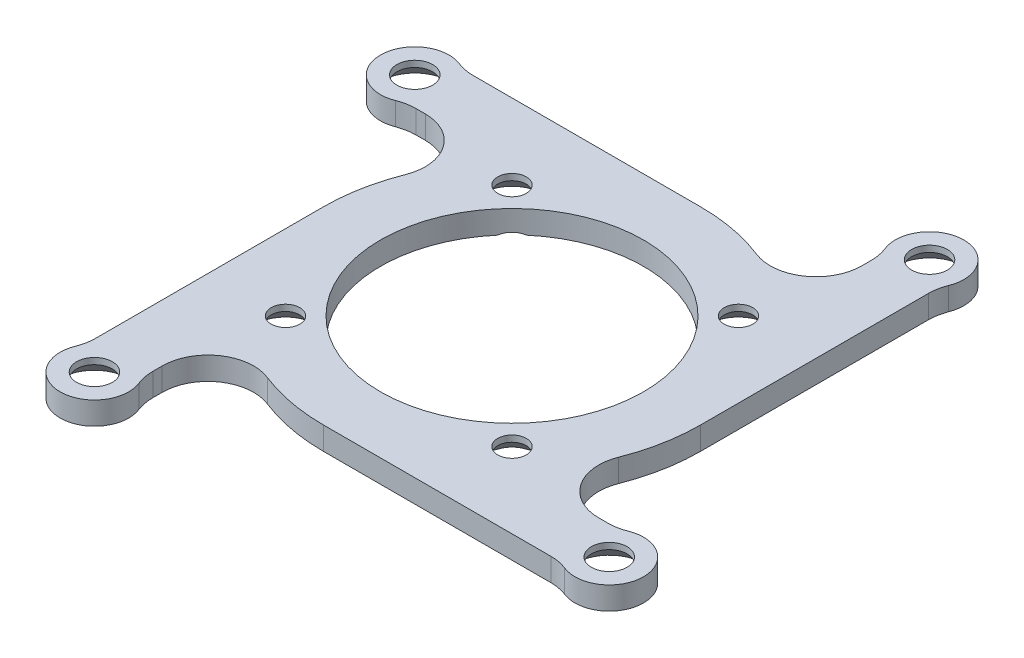
from build123d import *

# Parameters (mm, degrees)
SKETCH1_R           = 23
SKETCH1_R_2         = 2.5
SKETCH1_R_3         = 3.125
BOSS_EXTRUDE1_DEPTH = 4
FILLET1_R           = 8
CHAMFER1_SIZE       = 2.9


with BuildPart() as part:
    # Sketch1 → Boss-Extrude1 (new body)
    with BuildSketch(Plane(origin=(0, 0, 0), x_dir=(1, 0, 0), z_dir=(0, 1, 0))):
        with BuildLine():
            Line((-41.68337521, 33), (0, 33))
            ThreePointArc((0, 33), (12.411234198, 30.577136322), (23, 23.664319132))
            Line((23, 23.664319132), (23, 41.68337521))
            ThreePointArc((23, 41.68337521), (28, 51), (33, 41.68337521))
            Line((33, 41.68337521), (33, 0))
            ThreePointArc((33, 0), (30.577136322, -12.411234198), (23.664319132, -23))
            Line((23.664319132, -23), (41.68337521, -23))
            ThreePointArc((41.68337521, -23), (51, -28), (41.68337521, -33))
            Line((41.68337521, -33), (0, -33))
            ThreePointArc((0, -33), (-12.411234198, -30.577136322), (-23, -23.664319132))
            Line((-23, -23.664319132), (-23, -41.68337521))
            ThreePointArc((-23, -41.68337521), (-28, -51), (-33, -41.68337521))
            Line((-33, -41.68337521), (-33, 0))
            ThreePointArc((-33, 0), (-30.577136322, 12.411234198), (-23.664319132, 23))
            Line((-23.664319132, 23), (-41.68337521, 23))
            ThreePointArc((-41.68337521, 23), (-51, 28), (-41.68337521, 33))
        make_face()
        with Locations(Location((0, 0, 0), (0, 0, 270))):
            Circle(SKETCH1_R, mode=Mode.SUBTRACT)
        with Locations(Location((-19.798989873, 19.798989873, 0), (0, 0, 270))):
            Circle(SKETCH1_R_2, mode=Mode.SUBTRACT)
        with Locations(Location((19.798989873, 19.798989873, 0), (0, 0, 270))):
            Circle(SKETCH1_R_2, mode=Mode.SUBTRACT)
        with Locations(Location((19.798989873, -19.798989873, 0), (0, 0, 270))):
            Circle(SKETCH1_R_2, mode=Mode.SUBTRACT)
        with Locations(Location((-19.798989873, -19.798989873, 0), (0, 0, 270))):
            Circle(SKETCH1_R_2, mode=Mode.SUBTRACT)
        with Locations(Location((-45, 28, 0), (0, 0, 270))):
            Circle(SKETCH1_R_3, mode=Mode.SUBTRACT)
        with Locations(Location((28, 45, 0), (0, 0, 270))):
            Circle(SKETCH1_R_3, mode=Mode.SUBTRACT)
        with Locations(Location((45, -28, 0), (0, 0, 270))):
            Circle(SKETCH1_R_3, mode=Mode.SUBTRACT)
        with Locations(Location((-28, -45, 0), (0, 0, 270))):
            Circle(SKETCH1_R_3, mode=Mode.SUBTRACT)
    extrude(amount=BOSS_EXTRUDE1_DEPTH)

    # Fillet1
    fillet1_edges = [part.edges().sort_by_distance(p)[0] for p in [
        (-41.68337521, 2, -33),
        (23, 2, -23.664319132),
        (23, 2, -41.68337521),
        (33, 2, -41.68337521),
        (23.664319132, 2, 23),
        (41.68337521, 2, 23),
        (41.68337521, 2, 33),
        (-23, 2, 23.664319132),
        (-23, 2, 41.68337521),
        (-33, 2, 41.68337521),
        (-23.664319132, 2, -23),
        (-41.68337521, 2, -23),
    ]]
    fillet(fillet1_edges, radius=FILLET1_R)

    # Chamfer1
    # the kernel refuses this chamfer: 2.9 mm, written as the material it takes off along each edge
    with BuildSketch(Plane(origin=(-45, 0, -28), x_dir=(0, 0, 1), z_dir=(-1, 0, 0))) as chamfer1_piece_1:
        Polygon((3.125 + CHAMFER1_SIZE, 0), (3.125, CHAMFER1_SIZE), (3.125, 0), align=None)
    revolve(axis=Axis((-45, 0, -28), (0, 1, 0)), mode=Mode.SUBTRACT)
    with BuildSketch(Plane(origin=(-28, 0, 45), x_dir=(0, 0, 1), z_dir=(-1, 0, 0))) as chamfer1_piece_2:
        Polygon((3.125 + CHAMFER1_SIZE, 0), (3.125, CHAMFER1_SIZE), (3.125, 0), align=None)
    revolve(axis=Axis((-28, 0, 45), (0, 1, 0)), mode=Mode.SUBTRACT)
    with BuildSketch(Plane(origin=(45, 0, 28), x_dir=(0, 0, 1), z_dir=(-1, 0, 0))) as chamfer1_piece_3:
        Polygon((3.125 + CHAMFER1_SIZE, 0), (3.125, CHAMFER1_SIZE), (3.125, 0), align=None)
    revolve(axis=Axis((45, 0, 28), (0, 1, 0)), mode=Mode.SUBTRACT)
    with BuildSketch(Plane(origin=(28, 0, -45), x_dir=(0, 0, 1), z_dir=(-1, 0, 0))) as chamfer1_piece_4:
        Polygon((3.125 + CHAMFER1_SIZE, 0), (3.125, CHAMFER1_SIZE), (3.125, 0), align=None)
    revolve(axis=Axis((28, 0, -45), (0, 1, 0)), mode=Mode.SUBTRACT)
    with BuildSketch(Plane(origin=(19.798989873, 0, -19.798989873), x_dir=(0, 0, 1), z_dir=(-1, 0, 0))) as chamfer1_piece_5:
        Polygon((2.5 + CHAMFER1_SIZE, 0), (2.5, CHAMFER1_SIZE), (2.5, 0), align=None)
    revolve(axis=Axis((19.798989873, 0, -19.798989873), (0, 1, 0)), mode=Mode.SUBTRACT)
    with BuildSketch(Plane(origin=(19.798989873, 0, 19.798989873), x_dir=(0, 0, 1), z_dir=(-1, 0, 0))) as chamfer1_piece_6:
        Polygon((2.5 + CHAMFER1_SIZE, 0), (2.5, CHAMFER1_SIZE), (2.5, 0), align=None)
    revolve(axis=Axis((19.798989873, 0, 19.798989873), (0, 1, 0)), mode=Mode.SUBTRACT)
    with BuildSketch(Plane(origin=(-19.798989873, 0, 19.798989873), x_dir=(0, 0, 1), z_dir=(-1, 0, 0))) as chamfer1_piece_7:
        Polygon((2.5 + CHAMFER1_SIZE, 0), (2.5, CHAMFER1_SIZE), (2.5, 0), align=None)
    revolve(axis=Axis((-19.798989873, 0, 19.798989873), (0, 1, 0)), mode=Mode.SUBTRACT)
    with BuildSketch(Plane(origin=(-19.798989873, 0, -19.798989873), x_dir=(0, 0, 1), z_dir=(-1, 0, 0))) as chamfer1_piece_8:
        Polygon((2.5 + CHAMFER1_SIZE, 0), (2.5, CHAMFER1_SIZE), (2.5, 0), align=None)
    revolve(axis=Axis((-19.798989873, 0, -19.798989873), (0, 1, 0)), mode=Mode.SUBTRACT)

    # Chamfer2
    # the kernel refuses this chamfer: 1 mm, written as the material it takes off along each edge
    with BuildSketch(Plane(origin=(15, 0, -39.803847577), x_dir=(1, 0, 0), z_dir=(0, 0, 1))) as chamfer2_piece_1:
        with BuildLine():
            Line((9.028284271, -0.028284271), (7.971715729, 1.028284271))
            Line((7.971715729, 1.028284271), (7.951715729, 1.028284271))
            ThreePointArc((7.951715729, 1.028284271), (7.98, 0.514142136), (7.98, 0))
            Line((7.98, 0), (8, -0.02))
            ThreePointArc((8, -0.02), (8.514142136, -0.02), (9.028284271, -0.048284271))
            Line((9.028284271, -0.048284271), (9.028284271, -0.028284271))
        make_face()
    revolve(axis=Axis((15, 0, -39.803847577), (0, 1, 0)), revolution_arc=63.022782151, mode=Mode.SUBTRACT)
    with BuildSketch(Plane(origin=(23, 0, -38.157568057), x_dir=(0.9996219169112968, -0.02749587661058639, 0), z_dir=(0, 0, -1))) as chamfer2_piece_2:
        with BuildLine():
            Line((1.028673195, 0), (-0.056547155, -1.027117794))
            Line((-0.056547155, -1.027117794), (-0.076539593, -1.026567876))
            ThreePointArc((-0.076539593, -1.026567876), (-0.034129227, -0.51339783), (-0.019992438, 0.000549918))
            Line((-0.019992438, 0.000549918), (0.000549918, 0.019992438))
            ThreePointArc((0.000549918, 0.019992438), (0.514497665, 0.00585565), (1.029223113, 0.019992438))
            Line((1.029223113, 0.019992438), (1.028673195, 0))
        make_face()
    extrude(amount=1.646279521, mode=Mode.SUBTRACT)
    with BuildSketch(Plane(origin=(15, 0, -38.157568057), x_dir=(-0.3658536585365853, 0, 0.9306723916262885), z_dir=(-0.9306723916262885, 0, -0.3658536585365853))) as chamfer2_piece_3:
        with BuildLine():
            Line((9.028284271, -0.028284271), (7.971715729, 1.028284271))
            Line((7.971715729, 1.028284271), (7.951715729, 1.028284271))
            ThreePointArc((7.951715729, 1.028284271), (7.98, 0.514142136), (7.98, 0))
            Line((7.98, 0), (8, -0.02))
            ThreePointArc((8, -0.02), (8.514142136, -0.02), (9.028284271, -0.048284271))
            Line((9.028284271, -0.048284271), (9.028284271, -0.028284271))
        make_face()
    revolve(axis=Axis((15, 0, -38.157568057), (0, 1, 0)), revolution_arc=111.460127749, mode=Mode.SUBTRACT)
    with BuildSketch(Plane(origin=(0, 0, 0), x_dir=(0, 0, -1), z_dir=(-1, 0, 0))) as chamfer2_piece_4:
        with BuildLine():
            Line((31.971715729, 0.028284271), (33.028284271, -1.028284271))
            Line((33.028284271, -1.028284271), (33.048284271, -1.028284271))
            ThreePointArc((33.048284271, -1.028284271), (33.02, -0.514142136), (33.02, 0))
            Line((33.02, 0), (33, 0.02))
            ThreePointArc((33, 0.02), (32.485857864, 0.02), (31.971715729, 0.048284271))
            Line((31.971715729, 0.048284271), (31.971715729, 0.028284271))
        make_face()
    revolve(axis=Axis((0, 0, 0), (0, -1, 0)), revolution_arc=21.460127749, mode=Mode.SUBTRACT)
    with BuildSketch(Plane(origin=(-39.803847577, 0, -41), x_dir=(0, 0, 1), z_dir=(1, 0, 0))) as chamfer2_piece_5:
        with BuildLine():
            Line((9.028284271, 0.028284271), (7.971715729, -1.028284271))
            Line((7.971715729, -1.028284271), (7.951715729, -1.028284271))
            ThreePointArc((7.951715729, -1.028284271), (7.98, -0.514142136), (7.98, 0))
            Line((7.98, 0), (8, 0.02))
            ThreePointArc((8, 0.02), (8.514142136, 0.02), (9.028284271, 0.048284271))
            Line((9.028284271, 0.048284271), (9.028284271, 0.028284271))
        make_face()
    revolve(axis=Axis((-39.803847577, 0, -41), (0, -1, 0)), revolution_arc=63.022782151, mode=Mode.SUBTRACT)
    with BuildSketch(Plane(origin=(-39.803847577, 0, -33), x_dir=(0, 0.9996219169112968, -0.02749587661058908), z_dir=(1, 0, 0))) as chamfer2_piece_6:
        with BuildLine():
            Line((1.028673195, 0), (-0.056547155, 1.027117794))
            Line((-0.056547155, 1.027117794), (-0.076539593, 1.026567876))
            ThreePointArc((-0.076539593, 1.026567876), (-0.034129227, 0.51339783), (-0.019992438, -0.000549918))
            Line((-0.019992438, -0.000549918), (0.000549918, -0.019992438))
            ThreePointArc((0.000549918, -0.019992438), (0.514497665, -0.00585565), (1.029223113, -0.019992438))
            Line((1.029223113, -0.019992438), (1.028673195, 0))
        make_face()
    extrude(amount=39.803847577, mode=Mode.SUBTRACT)


solid = part.part
